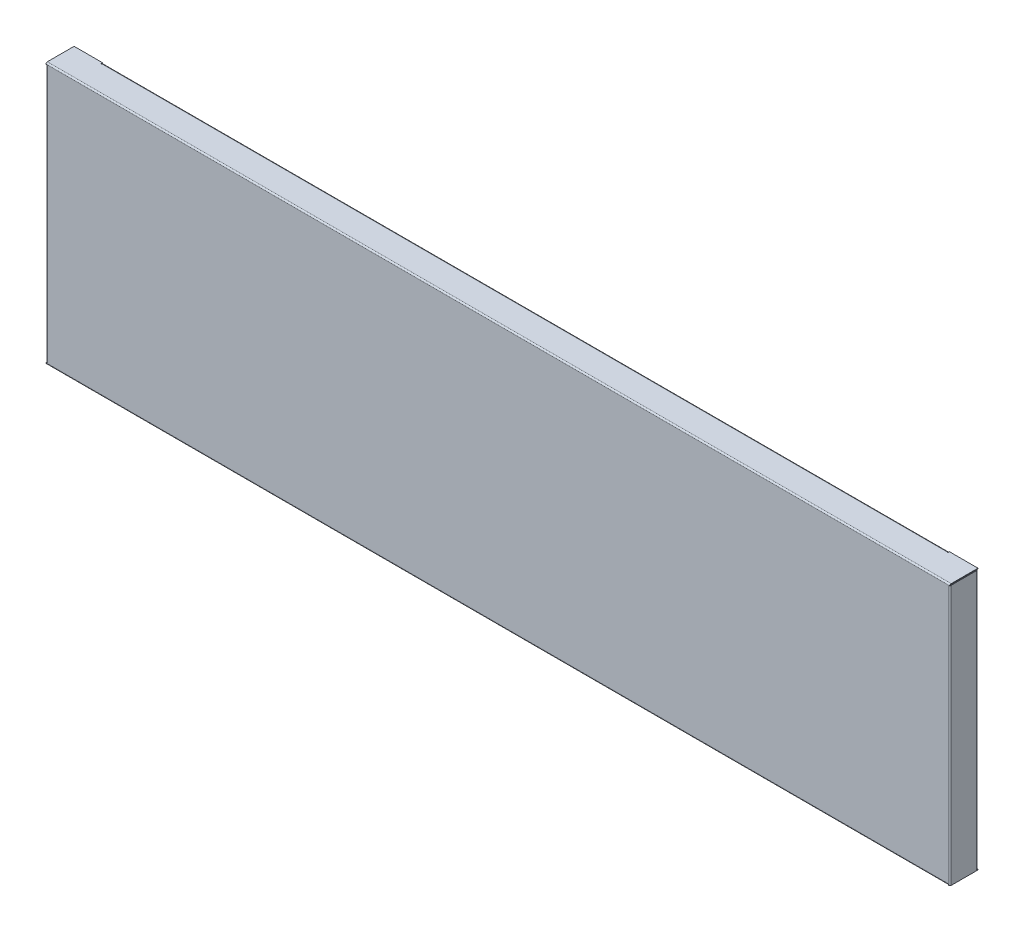
from build123d import *

# Parameters (mm, degrees)
SKETCH1_W                     = 965
SKETCH1_H                     = 279
BASE_FLANGE1_DEPTH            = 0.7366
EDGE_FLANGE1_STRIP_W          = 4.4196
EDGE_FLANGE1_STRIP_H          = 0.7366
EDGE_FLANGE1_STRIP_CUT_DEPTH  = 965
EDGE_FLANGE1_DEPTH            = 965
EDGE_FLANGE2_STRIP_W          = 4.4196
EDGE_FLANGE2_STRIP_H          = 0.7366
EDGE_FLANGE2_STRIP_CUT_DEPTH  = 277.5268
EDGE_FLANGE2_DEPTH            = 277.5268
EDGE_FLANGE3_STRIP_W          = 4.4196
EDGE_FLANGE3_STRIP_H          = 0.7366
EDGE_FLANGE3_STRIP_CUT_DEPTH  = 963.5268
EDGE_FLANGE3_DEPTH            = 963.5268
EDGE_FLANGE4_STRIP_W          = 4.4196
EDGE_FLANGE4_STRIP_H          = 0.7366
EDGE_FLANGE4_STRIP_CUT_DEPTH  = 276.0536
EDGE_FLANGE4_DEPTH            = 276.0536
EDGE_FLANGE5_STRIP_W          = 4.4196
EDGE_FLANGE5_STRIP_H          = 0.7366
EDGE_FLANGE5_STRIP_CUT_DEPTH  = 903.1268
EDGE_FLANGE5_RELIEF_W         = 4.7879
EDGE_FLANGE5_RELIEF_H         = 0.3683
EDGE_FLANGE5_RELIEF_CUT_DEPTH = 0.7366
EDGE_FLANGE5_DEPTH            = 903.1268
EDGE_FLANGE6_STRIP_W          = 4.4196
EDGE_FLANGE6_STRIP_H          = 0.7366
EDGE_FLANGE6_STRIP_CUT_DEPTH  = 903.1268
EDGE_FLANGE6_RELIEF_W         = 4.7879
EDGE_FLANGE6_RELIEF_H         = 0.3683
EDGE_FLANGE6_RELIEF_CUT_DEPTH = 0.7366
EDGE_FLANGE6_DEPTH            = 903.1268
EDGE_FLANGE7_STRIP_W          = 4.4196
EDGE_FLANGE7_STRIP_H          = 0.7366
EDGE_FLANGE7_STRIP_CUT_DEPTH  = 276.5902
EDGE_FLANGE7_RELIEF_W         = 4.7879
EDGE_FLANGE7_RELIEF_H         = 0.3683
EDGE_FLANGE7_RELIEF_CUT_DEPTH = 0.7366
EDGE_FLANGE7_DEPTH            = 276.5902
EDGE_FLANGE7_PROFILE_W        = 276.6268
EDGE_FLANGE7_PROFILE_H        = 28.5268
EDGE_FLANGE7_FLAT_DEPTH       = 0.7366
EDGE_FLANGE8_STRIP_W          = 4.4196
EDGE_FLANGE8_STRIP_H          = 0.7366
EDGE_FLANGE8_STRIP_CUT_DEPTH  = 276.0536
EDGE_FLANGE8_DEPTH            = 276.0536


# Sheet-metal steps are written as plain solids
with BuildPart() as part:
    # Sketch1 → Base-Flange1 (new body)
    with BuildSketch(Plane.XY):
        Rectangle(SKETCH1_W, SKETCH1_H)
    extrude(amount=-BASE_FLANGE1_DEPTH)

    # Edge-Flange1 strip (across the edge) → Edge-Flange1 strip cut (cut)
    with BuildSketch(Plane(origin=(-482.5, 139.5, -0.7366), x_dir=(0, -1, 0), z_dir=(1, 0, 0))):
        with Locations((-0.7366, -0.3683)):
            Rectangle(EDGE_FLANGE1_STRIP_W, EDGE_FLANGE1_STRIP_H)
    extrude(amount=EDGE_FLANGE1_STRIP_CUT_DEPTH, mode=Mode.SUBTRACT)

    # Edge-Flange1 section (across the edge) → Edge-Flange1 (add)
    with BuildSketch(Plane(origin=(-482.5, 139.5, -0.7366), x_dir=(0, -1, 0), z_dir=(1, 0, 0))):
        with BuildLine():
            Line((0, 0.7366), (0, 29.2634))
            Line((0, 29.2634), (0.7366, 29.2634))
            Line((0.7366, 29.2634), (0.7366, 0.7366))
            ThreePointArc((0.7366, 0.7366), (0.952345145, 0.215745145), (1.4732, 0))
            Line((1.4732, 0), (1.4732, -0.7366))
            ThreePointArc((1.4732, -0.7366), (0.43149029, -0.30510971), (0, 0.7366))
        make_face()
    extrude(amount=EDGE_FLANGE1_DEPTH)

    # Edge-Flange2 strip (across the edge) → Edge-Flange2 strip cut (cut)
    with BuildSketch(Plane(origin=(482.5, 138.0268, -0.7366), x_dir=(-1, 0, 0), z_dir=(0, -1, 0))):
        with Locations((-0.7366, -0.3683)):
            Rectangle(EDGE_FLANGE2_STRIP_W, EDGE_FLANGE2_STRIP_H)
    extrude(amount=EDGE_FLANGE2_STRIP_CUT_DEPTH, mode=Mode.SUBTRACT)

    # Edge-Flange2 section (across the edge) → Edge-Flange2 (add)
    with BuildSketch(Plane(origin=(482.5, 138.0268, -0.7366), x_dir=(-1, 0, 0), z_dir=(0, -1, 0))):
        with BuildLine():
            Line((0, 0.7366), (0, 29.2634))
            Line((0, 29.2634), (0.7366, 29.2634))
            Line((0.7366, 29.2634), (0.7366, 0.7366))
            ThreePointArc((0.7366, 0.7366), (0.952345145, 0.215745145), (1.4732, 0))
            Line((1.4732, 0), (1.4732, -0.7366))
            ThreePointArc((1.4732, -0.7366), (0.43149029, -0.30510971), (0, 0.7366))
        make_face()
    extrude(amount=EDGE_FLANGE2_DEPTH)

    # Edge-Flange3 strip (across the edge) → Edge-Flange3 strip cut (cut)
    with BuildSketch(Plane(origin=(481.0268, -139.5, -0.7366), x_dir=(0, 1, 0), z_dir=(-1, 0, 0))):
        with Locations((-0.7366, -0.3683)):
            Rectangle(EDGE_FLANGE3_STRIP_W, EDGE_FLANGE3_STRIP_H)
    extrude(amount=EDGE_FLANGE3_STRIP_CUT_DEPTH, mode=Mode.SUBTRACT)

    # Edge-Flange3 section (across the edge) → Edge-Flange3 (add)
    with BuildSketch(Plane(origin=(481.0268, -139.5, -0.7366), x_dir=(0, 1, 0), z_dir=(-1, 0, 0))):
        with BuildLine():
            Line((0, 0.7366), (0, 29.2634))
            Line((0, 29.2634), (0.7366, 29.2634))
            Line((0.7366, 29.2634), (0.7366, 0.7366))
            ThreePointArc((0.7366, 0.7366), (0.952345145, 0.215745145), (1.4732, 0))
            Line((1.4732, 0), (1.4732, -0.7366))
            ThreePointArc((1.4732, -0.7366), (0.43149029, -0.30510971), (0, 0.7366))
        make_face()
    extrude(amount=EDGE_FLANGE3_DEPTH)

    # Edge-Flange4 strip (across the edge) → Edge-Flange4 strip cut (cut)
    with BuildSketch(Plane(origin=(-482.5, -138.0268, -0.7366), x_dir=(1, 0, 0), z_dir=(0, 1, 0))):
        with Locations((-0.7366, -0.3683)):
            Rectangle(EDGE_FLANGE4_STRIP_W, EDGE_FLANGE4_STRIP_H)
    extrude(amount=EDGE_FLANGE4_STRIP_CUT_DEPTH, mode=Mode.SUBTRACT)

    # Edge-Flange4 section (across the edge) → Edge-Flange4 (add)
    with BuildSketch(Plane(origin=(-482.5, -138.0268, -0.7366), x_dir=(1, 0, 0), z_dir=(0, 1, 0))):
        with BuildLine():
            Line((0, 0.7366), (0, 29.2634))
            Line((0, 29.2634), (0.7366, 29.2634))
            Line((0.7366, 29.2634), (0.7366, 0.7366))
            ThreePointArc((0.7366, 0.7366), (0.952345145, 0.215745145), (1.4732, 0))
            Line((1.4732, 0), (1.4732, -0.7366))
            ThreePointArc((1.4732, -0.7366), (0.43149029, -0.30510971), (0, 0.7366))
        make_face()
    extrude(amount=EDGE_FLANGE4_DEPTH)

    # Edge-Flange5 strip (across the edge) → Edge-Flange5 strip cut (cut)
    with BuildSketch(Plane(origin=(451.5634, -138.7634, -30), x_dir=(0, 0, 1), z_dir=(-1, 0, 0))):
        with Locations((-0.7366, -0.3683)):
            Rectangle(EDGE_FLANGE5_STRIP_W, EDGE_FLANGE5_STRIP_H)
    extrude(amount=EDGE_FLANGE5_STRIP_CUT_DEPTH, mode=Mode.SUBTRACT)

    # Edge-Flange5 relief (on the sheet) → Edge-Flange5 relief cut (cut)
    with BuildSketch(Plane(origin=(451.5634, -138.7634, -28.5268), x_dir=(0, 0, 1), z_dir=(0, 1, 0))):
        with Locations((-2.02565, 0.18415)):
            Rectangle(EDGE_FLANGE5_RELIEF_W, EDGE_FLANGE5_RELIEF_H)
        with Locations((-2.02565, -903.31095)):
            Rectangle(EDGE_FLANGE5_RELIEF_W, EDGE_FLANGE5_RELIEF_H)
    extrude(amount=-EDGE_FLANGE5_RELIEF_CUT_DEPTH, mode=Mode.SUBTRACT)

    # Edge-Flange5 section (across the edge) → Edge-Flange5 (add)
    with BuildSketch(Plane(origin=(451.5634, -138.7634, -30), x_dir=(0, 0, 1), z_dir=(-1, 0, 0))):
        with BuildLine():
            Line((0, 0.7366), (0, 29.2634))
            Line((0, 29.2634), (0.7366, 29.2634))
            Line((0.7366, 29.2634), (0.7366, 0.7366))
            ThreePointArc((0.7366, 0.7366), (0.952345145, 0.215745145), (1.4732, 0))
            Line((1.4732, 0), (1.4732, -0.7366))
            ThreePointArc((1.4732, -0.7366), (0.43149029, -0.30510971), (0, 0.7366))
        make_face()
    extrude(amount=EDGE_FLANGE5_DEPTH)

    # Edge-Flange6 strip (across the edge) → Edge-Flange6 strip cut (cut)
    with BuildSketch(Plane(origin=(-451.5634, 138.7634, -30), x_dir=(0, 0, 1), z_dir=(1, 0, 0))):
        with Locations((-0.7366, -0.3683)):
            Rectangle(EDGE_FLANGE6_STRIP_W, EDGE_FLANGE6_STRIP_H)
    extrude(amount=EDGE_FLANGE6_STRIP_CUT_DEPTH, mode=Mode.SUBTRACT)

    # Edge-Flange6 relief (on the sheet) → Edge-Flange6 relief cut (cut)
    with BuildSketch(Plane(origin=(-451.5634, 138.7634, -28.5268), x_dir=(0, 0, 1), z_dir=(0, -1, 0))):
        with Locations((-2.02565, 0.18415)):
            Rectangle(EDGE_FLANGE6_RELIEF_W, EDGE_FLANGE6_RELIEF_H)
        with Locations((-2.02565, -903.31095)):
            Rectangle(EDGE_FLANGE6_RELIEF_W, EDGE_FLANGE6_RELIEF_H)
    extrude(amount=-EDGE_FLANGE6_RELIEF_CUT_DEPTH, mode=Mode.SUBTRACT)

    # Edge-Flange6 section (across the edge) → Edge-Flange6 (add)
    with BuildSketch(Plane(origin=(-451.5634, 138.7634, -30), x_dir=(0, 0, 1), z_dir=(1, 0, 0))):
        with BuildLine():
            Line((0, 0.7366), (0, 29.2634))
            Line((0, 29.2634), (0.7366, 29.2634))
            Line((0.7366, 29.2634), (0.7366, 0.7366))
            ThreePointArc((0.7366, 0.7366), (0.952345145, 0.215745145), (1.4732, 0))
            Line((1.4732, 0), (1.4732, -0.7366))
            ThreePointArc((1.4732, -0.7366), (0.43149029, -0.30510971), (0, 0.7366))
        make_face()
    extrude(amount=EDGE_FLANGE6_DEPTH)

    # Edge-Flange7 strip (across the edge) → Edge-Flange7 strip cut (cut)
    with BuildSketch(Plane(origin=(481.7634, 138.0268, -30), x_dir=(0, 0, 1), z_dir=(0, -1, 0))):
        with Locations((-0.7366, -0.3683)):
            Rectangle(EDGE_FLANGE7_STRIP_W, EDGE_FLANGE7_STRIP_H)
    extrude(amount=EDGE_FLANGE7_STRIP_CUT_DEPTH, mode=Mode.SUBTRACT)

    # Edge-Flange7 relief (on the sheet) → Edge-Flange7 relief cut (cut)
    with BuildSketch(Plane(origin=(481.7634, 138.0268, -28.5268), x_dir=(0, 0, 1), z_dir=(-1, 0, 0))):
        with Locations((-2.02565, -276.77435)):
            Rectangle(EDGE_FLANGE7_RELIEF_W, EDGE_FLANGE7_RELIEF_H)
    extrude(amount=-EDGE_FLANGE7_RELIEF_CUT_DEPTH, mode=Mode.SUBTRACT)

    # Edge-Flange7 bend section (across the edge) → Edge-Flange7 (add)
    with BuildSketch(Plane(origin=(481.7634, 138.0268, -30), x_dir=(0, 0, 1), z_dir=(0, -1, 0))):
        with BuildLine():
            Line((0, 0.7366), (0.7366, 0.7366))
            ThreePointArc((0.7366, 0.7366), (0.952345145, 0.215745145), (1.4732, 0))
            Line((1.4732, 0), (1.4732, -0.7366))
            ThreePointArc((1.4732, -0.7366), (0.43149029, -0.30510971), (0, 0.7366))
        make_face()
    extrude(amount=EDGE_FLANGE7_DEPTH)

    # Edge-Flange7 profile (on flange) → Edge-Flange7 flat (add)
    with BuildSketch(Plane(origin=(481.7634, 0, -30), x_dir=(0, 1, 0), z_dir=(0, 0, 1))):
        with Locations((-0.25, 15)):
            Rectangle(EDGE_FLANGE7_PROFILE_W, EDGE_FLANGE7_PROFILE_H)
    extrude(amount=EDGE_FLANGE7_FLAT_DEPTH)

    # Edge-Flange8 strip (across the edge) → Edge-Flange8 strip cut (cut)
    with BuildSketch(Plane(origin=(-481.7634, -138.0268, -30), x_dir=(0, 0, 1), z_dir=(0, 1, 0))):
        with Locations((-0.7366, -0.3683)):
            Rectangle(EDGE_FLANGE8_STRIP_W, EDGE_FLANGE8_STRIP_H)
    extrude(amount=EDGE_FLANGE8_STRIP_CUT_DEPTH, mode=Mode.SUBTRACT)

    # Edge-Flange8 section (across the edge) → Edge-Flange8 (add)
    with BuildSketch(Plane(origin=(-481.7634, -138.0268, -30), x_dir=(0, 0, 1), z_dir=(0, 1, 0))):
        with BuildLine():
            Line((0, 0.7366), (0, 29.2634))
            Line((0, 29.2634), (0.7366, 29.2634))
            Line((0.7366, 29.2634), (0.7366, 0.7366))
            ThreePointArc((0.7366, 0.7366), (0.952345145, 0.215745145), (1.4732, 0))
            Line((1.4732, 0), (1.4732, -0.7366))
            ThreePointArc((1.4732, -0.7366), (0.43149029, -0.30510971), (0, 0.7366))
        make_face()
    extrude(amount=EDGE_FLANGE8_DEPTH)


solid = part.part
